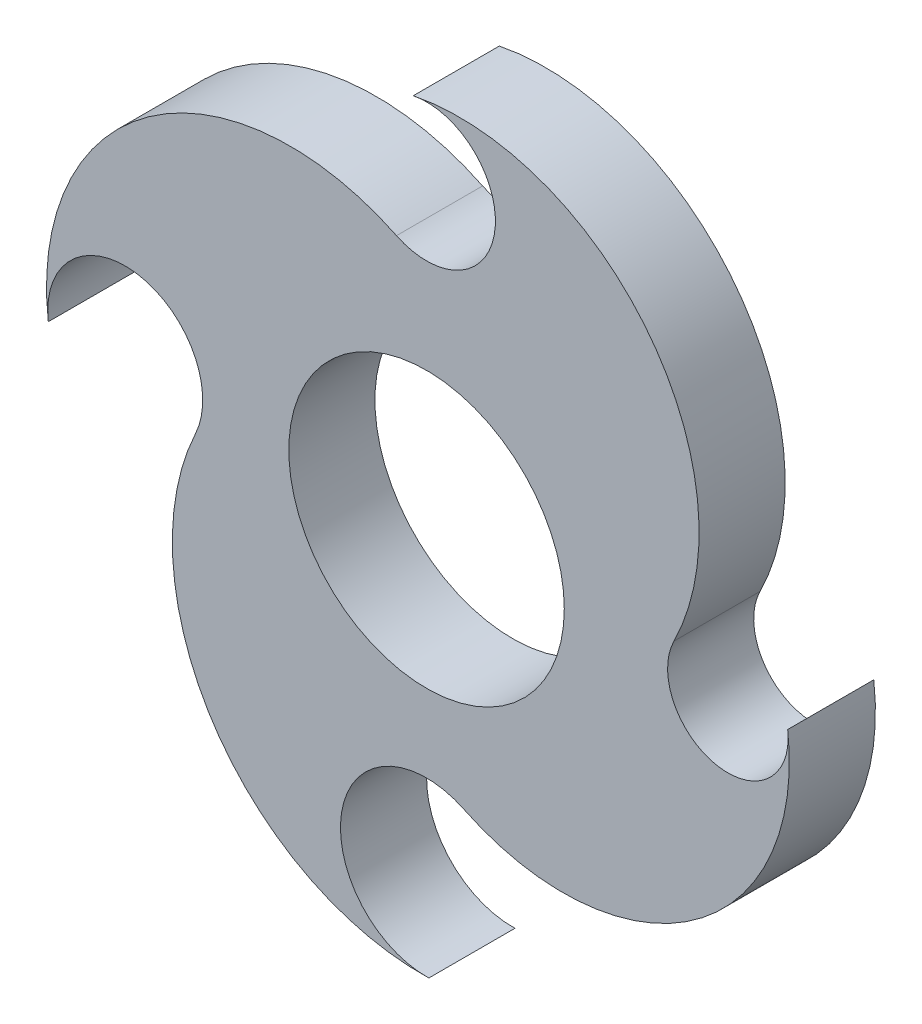
from build123d import *

# Parameters (mm, degrees)
SKETCH_1_R      = 16
EXTRUDE_1_DEPTH = 10


with BuildPart() as part:
    # 草圖1 → 填料-伸長1 (new body)
    with BuildSketch(Plane.XY):
        with BuildLine():
            ThreePointArc((0.269351883, -44.99637182), (-9.775916895, -32.894899322), (4.35984405, -26.000457797))
            ThreePointArc((4.35984405, -26.000457797), (31.120076714, -23.733893133), (41.949166165, 0.842074586))
            ThreePointArc((41.949166165, 0.842074586), (33.809796572, -6.89807334), (28.734817689, 3.122097149))
            ThreePointArc((28.734817689, 3.122097149), (25.960646283, 32.408556044), (-1.541484285, 42.850084471))
            ThreePointArc((-1.541484285, 42.850084471), (7.933922046, 33.973900118), (-3.48787524, 27.800366238))
            ThreePointArc((-3.48787524, 27.800366238), (-32.282352868, 25.36150308), (-43.934642212, -1.082667325))
            ThreePointArc((-43.934642212, -1.082667325), (-33.594597906, 8.889591945), (-26.835075194, -3.786027326))
            ThreePointArc((-26.835075194, -3.786027326), (-24.753948183, -31.935839932), (0.269351883, -44.99637182))
        make_face()
        Circle(SKETCH_1_R, mode=Mode.SUBTRACT)
    extrude(amount=EXTRUDE_1_DEPTH)


solid = part.part
